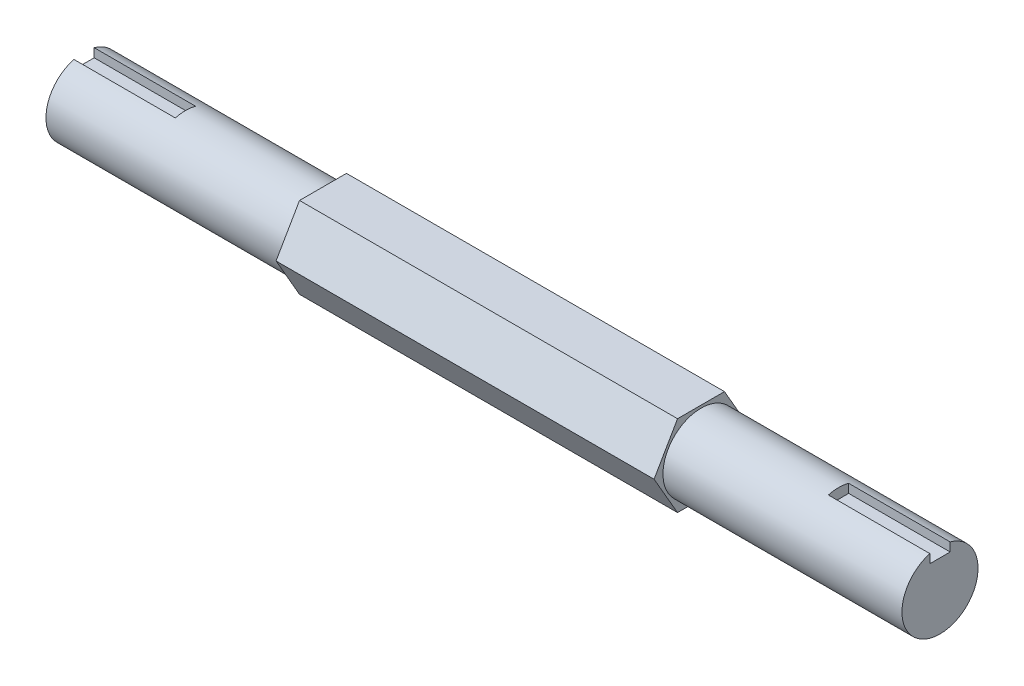
from build123d import *

# Parameters (mm, degrees)
SKETCH1_R           = 15
BOSS_EXTRUDE2_DEPTH = 168.7
BOSS_EXTRUDE3_DEPTH = 74.5
SKETCH3_W           = 8
SKETCH3_H           = 4
CUT_EXTRUDE1_DEPTH  = 40


with BuildPart() as part:
    # Sketch1 → Boss-Extrude2 (new, symmetric)
    with BuildSketch(Plane(origin=(0, 0, 0), x_dir=(0, 0, -1), z_dir=(1, 0, 0))):
        Circle(SKETCH1_R)
    extrude(amount=BOSS_EXTRUDE2_DEPTH, both=True)

    # Sketch2 → Boss-Extrude3 (add, symmetric)
    with BuildSketch(Plane(origin=(0, 0, 0), x_dir=(0, 0, -1), z_dir=(1, 0, 0))):
        Polygon((-18.504076128, 0), (-9.252038064, -16.025), (9.252038064, -16.025), (18.504076128, 0), (9.252038064, 16.025), (-9.252038064, 16.025), align=None)
    extrude(amount=BOSS_EXTRUDE3_DEPTH, both=True)

    # Sketch3 → Cut-Extrude1 (cut)
    with BuildSketch(Plane(origin=(168.7, 0, 0), x_dir=(0, 0, -1), z_dir=(1, 0, 0))):
        with Locations((0, 13)):
            Rectangle(SKETCH3_W, SKETCH3_H)
    cut_extrude1 = extrude(amount=-CUT_EXTRUDE1_DEPTH, mode=Mode.SUBTRACT)

    # Mirror1: Cut-Extrude1 across plane
    add(cut_extrude1.mirror(Plane(origin=(0, 0, 0), x_dir=(0, 0, 1), z_dir=(1, 0, 0))), mode=Mode.SUBTRACT)


solid = part.part
